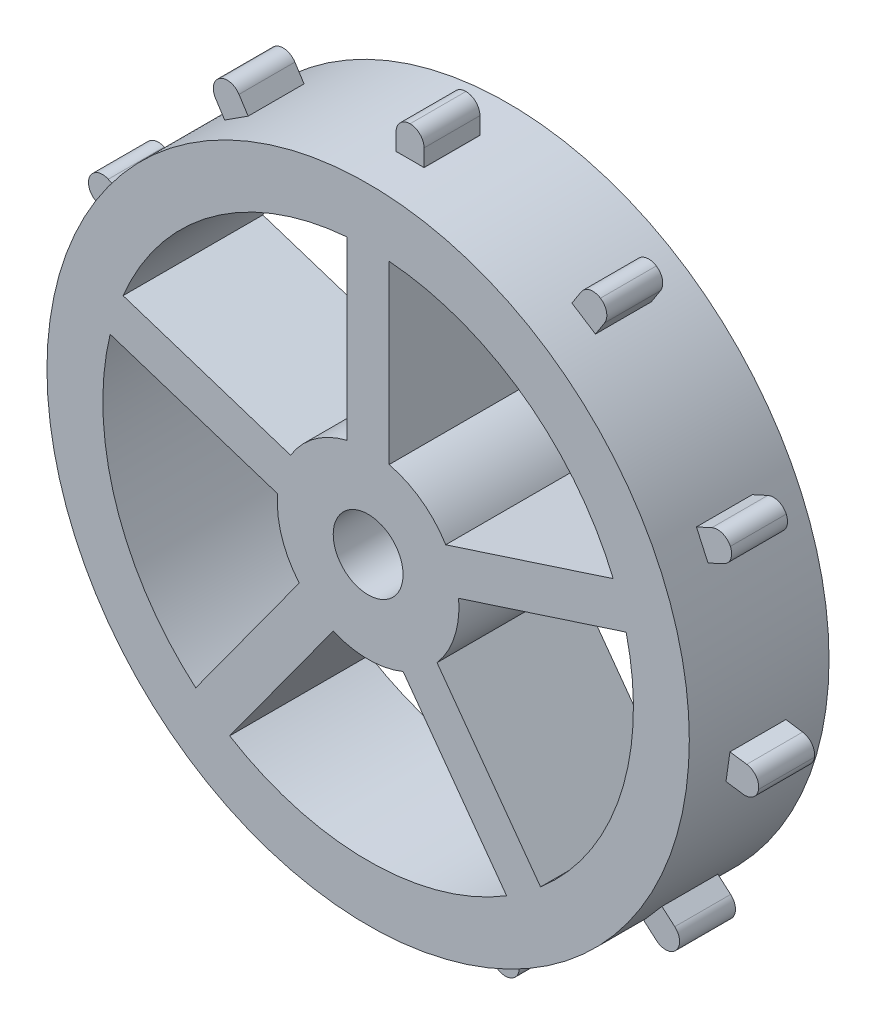
from build123d import *

# Parameters (mm, degrees)
BOSS_EXTRUDE1_DEPTH    = 4
BOSS_EXTRUDE1_2_DEPTH  = 4
BOSS_EXTRUDE1_3_DEPTH  = 4
BOSS_EXTRUDE1_4_DEPTH  = 4
BOSS_EXTRUDE1_5_DEPTH  = 4
BOSS_EXTRUDE1_6_DEPTH  = 4
BOSS_EXTRUDE1_7_DEPTH  = 4
BOSS_EXTRUDE1_8_DEPTH  = 4
BOSS_EXTRUDE1_9_DEPTH  = 4
BOSS_EXTRUDE1_10_DEPTH = 4
BOSS_EXTRUDE1_11_DEPTH = 4
BOSS_EXTRUDE1_12_DEPTH = 4
SKETCH5_R              = 22.988388863
BOSS_EXTRUDE3_DEPTH    = 3
SKETCH6_R              = 22.988388863
BOSS_EXTRUDE4_DEPTH    = 3
SKETCH7_R              = 2.5
CUT_EXTRUDE1_DEPTH     = 10
CUT_EXTRUDE2_DEPTH     = 10
FILLET1_R              = 1
FILLET2_R              = 1
FILLET3_R              = 1
FILLET4_R              = 1
FILLET5_R              = 1
FILLET6_R              = 1
FILLET7_R              = 1
FILLET8_R              = 1
FILLET9_R              = 1
FILLET10_R             = 1
FILLET11_R             = 1


with BuildPart() as part:
    # Sketch2 → Boss-Extrude1 (new body)
    with BuildSketch(Plane.XY):
        with BuildLine():
            Line((-1, 24.966628453), (-1, 22.988388863))
            Line((-1, 22.988388863), (1, 22.988388863))
            Line((1, 22.988388863), (1, 24.966628453))
            ThreePointArc((1, 24.966628453), (0, 25.20269643), (-1, 24.966628453))
        make_face()
    extrude(amount=BOSS_EXTRUDE1_DEPTH)

    # Fillet1
    fillet1_edges = [part.edges().sort_by_distance(p)[0] for p in [
        (-1, 24.966628453, 2),
        (1, 24.966628453, 2),
    ]]
    fillet(fillet1_edges, radius=FILLET1_R - 0.0001)  # a hair under: the kernel refuses the full size


with BuildPart() as body_2:
    # Sketch2 → Boss-Extrude1 2 (new body)
    with BuildSketch(Plane.XY):
        with BuildLine():
            Line((-13.269714879, 18.798422527), (-12.428461559, 19.339063208))
            Line((-12.428461559, 19.339063208), (-11.587207814, 19.879704162))
            Line((-11.587207814, 19.879704162), (-12.656724883, 21.543905206))
            ThreePointArc((-12.656724883, 21.543905206), (-13.6256064, 21.201857409), (-14.339231949, 20.462623571))
            Line((-14.339231949, 20.462623571), (-13.269714879, 18.798422527))
        make_face()
    extrude(amount=BOSS_EXTRUDE1_2_DEPTH)

    # Fillet2
    fillet2_edges = [body_2.edges().sort_by_distance(p)[0] for p in [
        (-14.339231949, 20.462623571, 2),
        (-12.656724883, 21.543905206, 2),
    ]]
    fillet(fillet2_edges, radius=FILLET2_R - 0.0001)  # a hair under: the kernel refuses the full size


with BuildPart() as body_3:
    # Sketch2 → Boss-Extrude1 3 (new body)
    with BuildSketch(Plane.XY):
        with BuildLine():
            Line((1, 22.966628453), (-1, 22.966628453))
            ThreePointArc((-1, 22.966628453), (-6.954904914, 21.911077567), (-12.428461559, 19.339063208))
            ThreePointArc((-12.428461559, 19.339063208), (-17.373465046, 15.054193263), (-20.910973859, 9.549722234))
            ThreePointArc((-20.910973859, 9.549722234), (-22.754400197, 3.271588939), (-22.754400179, -3.271589061))
            ThreePointArc((-22.754400179, -3.271589061), (-20.91097412, -9.549721663), (-17.373465524, -15.054192711))
            ThreePointArc((-17.373465524, -15.054192711), (-12.428461917, -19.339062978), (-6.47657825, -22.057197389))
            ThreePointArc((-6.47657825, -22.057197389), (0, -22.988388863), (6.47657825, -22.057197389))
            ThreePointArc((6.47657825, -22.057197389), (12.42846186, -19.339063015), (17.373465435, -15.054192814))
            ThreePointArc((17.373465435, -15.054192814), (20.910974105, -9.549721696), (22.754400188, -3.271588999))
            ThreePointArc((22.754400188, -3.271588999), (22.754400262, 3.271588485), (20.910974266, 9.549721344))
            ThreePointArc((20.910974266, 9.549721344), (17.373465478, 15.054192764), (12.428461848, 19.339063022))
            ThreePointArc((12.428461848, 19.339063022), (6.954905078, 21.911077515), (1, 22.966628453))
        make_face()
    extrude(amount=BOSS_EXTRUDE1_3_DEPTH)

    # Sketch5 → Boss-Extrude3 (add)
    with BuildSketch(Plane.XY.offset(4)):
        with Locations(Location((0, 0, 0), (0, 0, 92.493165793))):
            Circle(SKETCH5_R)
    extrude(amount=BOSS_EXTRUDE3_DEPTH)

    # Sketch6 → Boss-Extrude4 (add)
    with BuildSketch(Plane(origin=(0, 0, 0), x_dir=(-1, 0, 0), z_dir=(0, 0, -1))):
        Circle(SKETCH6_R)
    extrude(amount=BOSS_EXTRUDE4_DEPTH)

    # Sketch7 → Cut-Extrude1 (cut)
    with BuildSketch(Plane(origin=(0, 0, -3), x_dir=(-1, 0, 0), z_dir=(0, 0, -1))):
        Circle(SKETCH7_R)
    extrude(amount=-CUT_EXTRUDE1_DEPTH, mode=Mode.SUBTRACT)

    # Sketch8 → Cut-Extrude2 (cut)
    with BuildSketch(Plane(origin=(0, 0, -3), x_dir=(-1, 0, 0), z_dir=(0, 0, -1))):
        with BuildLine():
            ThreePointArc((-5.551484059, 3.38097985), (-3.82060414, 5.258610463), (-1.5, 6.32455532))
            Line((-1.5, 6.32455532), (-1.5, 18.929049411))
            ThreePointArc((-1.5, 18.929049411), (-11.161094938, 15.361929286), (-17.539070298, 7.27598273))
            Line((-17.539070298, 7.27598273), (-5.551484059, 3.38097985))
        make_face()
        with BuildLine():
            Line((1.5, 18.929049411), (1.5, 6.32455532))
            ThreePointArc((1.5, 6.32455532), (3.82060414, 5.258610463), (5.551484059, 3.38097985))
            Line((5.551484059, 3.38097985), (17.539070298, 7.27598273))
            ThreePointArc((17.539070298, 7.27598273), (11.161094938, 15.361929286), (1.5, 18.929049411))
        make_face()
        with BuildLine():
            Line((18.466121281, 4.422813181), (6.478535042, 0.527810301))
            ThreePointArc((6.478535042, 0.527810301), (6.494631543, 0.264123294), (6.5, 0))
            ThreePointArc((6.5, 0), (6.095143064, -2.258147699), (4.931005836, -4.234994858))
            Line((4.931005836, -4.234994858), (12.339741575, -14.432244782))
            ThreePointArc((12.339741575, -14.432244782), (17.246314434, -7.945033043), (18.988388863, 0))
            ThreePointArc((18.988388863, 0), (18.857369955, 2.226771197), (18.466121281, 4.422813181))
        make_face()
        with BuildLine():
            ThreePointArc((2.503954853, -5.998350614), (0, -6.5), (-2.503954853, -5.998350614))
            Line((-2.503954853, -5.998350614), (-9.912690592, -16.195600539))
            ThreePointArc((-9.912690592, -16.195600539), (0, -18.988388863), (9.912690592, -16.195600539))
            Line((9.912690592, -16.195600539), (2.503954853, -5.998350614))
        make_face()
        with BuildLine():
            ThreePointArc((-4.931005836, -4.234994858), (-6.181867356, -2.008610463), (-6.478535042, 0.527810301))
            Line((-6.478535042, 0.527810301), (-18.466121281, 4.422813181))
            ThreePointArc((-18.466121281, 4.422813181), (-18.059030962, -5.867734854), (-12.339741575, -14.432244782))
            Line((-12.339741575, -14.432244782), (-4.931005836, -4.234994858))
        make_face()
    extrude(amount=-CUT_EXTRUDE2_DEPTH, mode=Mode.SUBTRACT)


with BuildPart() as body_4:
    # Sketch2 → Boss-Extrude1 4 (new body)
    with BuildSketch(Plane.XY):
        with BuildLine():
            Line((12.656724883, 21.543905206), (11.587207814, 19.879704162))
            Line((11.587207814, 19.879704162), (12.428461848, 19.339063022))
            Line((12.428461848, 19.339063022), (13.269714879, 18.798422527))
            Line((13.269714879, 18.798422527), (14.339231949, 20.462623571))
            ThreePointArc((14.339231949, 20.462623571), (13.6256064, 21.201857409), (12.656724883, 21.543905206))
        make_face()
    extrude(amount=BOSS_EXTRUDE1_4_DEPTH)

    # Fillet8
    fillet8_edges = [body_4.edges().sort_by_distance(p)[0] for p in [
        (14.339231949, 20.462623571, 2),
        (12.656724883, 21.543905206, 2),
    ]]
    fillet(fillet8_edges, radius=FILLET8_R - 0.0001)  # a hair under: the kernel refuses the full size


with BuildPart() as body_5:
    # Sketch2 → Boss-Extrude1 5 (new body)
    with BuildSketch(Plane.XY):
        with BuildLine():
            Line((-20.910973859, 9.549722234), (-20.495559018, 10.459353854))
            Line((-20.495559018, 10.459353854), (-22.295029044, 11.281144279))
            ThreePointArc((-22.295029044, 11.281144279), (-22.925179042, 10.469578465), (-23.12585907, 9.461880288))
            Line((-23.12585907, 9.461880288), (-21.326389044, 8.640089863))
            Line((-21.326389044, 8.640089863), (-20.910973859, 9.549722234))
        make_face()
    extrude(amount=BOSS_EXTRUDE1_5_DEPTH)

    # Fillet3
    fillet3_edges = [body_5.edges().sort_by_distance(p)[0] for p in [
        (-23.12585907, 9.461880288, 2),
        (-22.295029044, 11.281144279, 2),
    ]]
    fillet(fillet3_edges, radius=FILLET3_R - 0.0001)  # a hair under: the kernel refuses the full size


with BuildPart() as body_6:
    # Sketch2 → Boss-Extrude1 6 (new body)
    with BuildSketch(Plane.XY):
        with BuildLine():
            Line((22.295029044, 11.281144279), (20.495559018, 10.459353854))
            Line((20.495559018, 10.459353854), (20.910974266, 9.549721344))
            Line((20.910974266, 9.549721344), (21.326389044, 8.640089863))
            Line((21.326389044, 8.640089863), (23.12585907, 9.461880288))
            ThreePointArc((23.12585907, 9.461880288), (22.925179042, 10.469578465), (22.295029044, 11.281144279))
        make_face()
    extrude(amount=BOSS_EXTRUDE1_6_DEPTH)

    # Fillet9
    fillet9_edges = [body_6.edges().sort_by_distance(p)[0] for p in [
        (22.295029044, 11.281144279, 2),
        (23.12585907, 9.461880288, 2),
    ]]
    fillet(fillet9_edges, radius=FILLET9_R - 0.0001)  # a hair under: the kernel refuses the full size


with BuildPart() as body_7:
    # Sketch2 → Boss-Extrude1 7 (new body)
    with BuildSketch(Plane.XY):
        with BuildLine():
            Line((-22.754400179, -3.271589061), (-22.896715049, -2.281767401))
            Line((-22.896715049, -2.281767401), (-24.854819012, -2.563300249))
            ThreePointArc((-24.854819012, -2.563300249), (-24.94616932, -3.586717667), (-24.570189336, -4.542943132))
            Line((-24.570189336, -4.542943132), (-22.612085372, -4.261410285))
            Line((-22.612085372, -4.261410285), (-22.754400179, -3.271589061))
        make_face()
    extrude(amount=BOSS_EXTRUDE1_7_DEPTH)

    # Fillet4
    fillet4_edges = [body_7.edges().sort_by_distance(p)[0] for p in [
        (-24.854819012, -2.563300249, 2),
        (-24.570189336, -4.542943132, 2),
    ]]
    fillet(fillet4_edges, radius=FILLET4_R - 0.0001)  # a hair under: the kernel refuses the full size


with BuildPart() as body_8:
    # Sketch2 → Boss-Extrude1 8 (new body)
    with BuildSketch(Plane.XY):
        with BuildLine():
            Line((24.854819012, -2.563300249), (22.896715049, -2.281767401))
            Line((22.896715049, -2.281767401), (22.754400188, -3.271588999))
            Line((22.754400188, -3.271588999), (22.612085372, -4.261410285))
            Line((22.612085372, -4.261410285), (24.570189336, -4.542943132))
            ThreePointArc((24.570189336, -4.542943132), (24.94616932, -3.586717667), (24.854819012, -2.563300249))
        make_face()
    extrude(amount=BOSS_EXTRUDE1_8_DEPTH)

    # Fillet10
    fillet10_edges = [body_8.edges().sort_by_distance(p)[0] for p in [
        (24.854819012, -2.563300249, 2),
        (24.570189336, -4.542943132, 2),
    ]]
    fillet(fillet10_edges, radius=FILLET10_R - 0.0001)  # a hair under: the kernel refuses the full size


with BuildPart() as body_9:
    # Sketch2 → Boss-Extrude1 9 (new body)
    with BuildSketch(Plane.XY):
        with BuildLine():
            Line((-17.373465524, -15.054192711), (-18.028325832, -14.298443628))
            Line((-18.028325832, -14.298443628), (-19.52337956, -15.593915058))
            ThreePointArc((-19.52337956, -15.593915058), (-19.0469271, -16.504256282), (-18.213658092, -17.105414207))
            Line((-18.213658092, -17.105414207), (-16.718604364, -15.809942777))
            Line((-16.718604364, -15.809942777), (-17.373465524, -15.054192711))
        make_face()
    extrude(amount=BOSS_EXTRUDE1_9_DEPTH)

    # Fillet5
    fillet5_edges = [body_9.edges().sort_by_distance(p)[0] for p in [
        (-18.213658092, -17.105414207, 2),
        (-19.52337956, -15.593915058, 2),
    ]]
    fillet(fillet5_edges, radius=FILLET5_R - 0.0001)  # a hair under: the kernel refuses the full size


with BuildPart() as body_10:
    # Sketch2 → Boss-Extrude1 10 (new body)
    with BuildSketch(Plane.XY):
        with BuildLine():
            Line((-6.47657825, -22.057197389), (-7.436070546, -21.775465031))
            Line((-7.436070546, -21.775465031), (-7.993405043, -23.673572019))
            ThreePointArc((-7.993405043, -23.673572019), (-7.100420105, -24.181810141), (-6.074419096, -24.237037132))
            Line((-6.074419096, -24.237037132), (-5.517084598, -22.338930145))
            Line((-5.517084598, -22.338930145), (-6.47657825, -22.057197389))
        make_face()
    extrude(amount=BOSS_EXTRUDE1_10_DEPTH)

    # Fillet6
    fillet6_edges = [body_10.edges().sort_by_distance(p)[0] for p in [
        (-7.993405043, -23.673572019, 2),
        (-6.074419096, -24.237037132, 2),
    ]]
    fillet(fillet6_edges, radius=FILLET6_R - 0.0001)  # a hair under: the kernel refuses the full size


with BuildPart() as body_11:
    # Sketch2 → Boss-Extrude1 11 (new body)
    with BuildSketch(Plane.XY):
        with BuildLine():
            Line((19.52337956, -15.593915058), (18.028325832, -14.298443628))
            Line((18.028325832, -14.298443628), (17.373465435, -15.054192814))
            Line((17.373465435, -15.054192814), (16.718604364, -15.809942777))
            Line((16.718604364, -15.809942777), (18.213658092, -17.105414207))
            ThreePointArc((18.213658092, -17.105414207), (19.0469271, -16.504256282), (19.52337956, -15.593915058))
        make_face()
    extrude(amount=BOSS_EXTRUDE1_11_DEPTH)

    # Fillet11
    fillet11_edges = [body_11.edges().sort_by_distance(p)[0] for p in [
        (18.213658092, -17.105414207, 2),
        (19.52337956, -15.593915058, 2),
    ]]
    fillet(fillet11_edges, radius=FILLET11_R - 0.0001)  # a hair under: the kernel refuses the full size


with BuildPart() as body_12:
    # Sketch2 → Boss-Extrude1 12 (new body)
    with BuildSketch(Plane.XY):
        with BuildLine():
            Line((6.47657825, -22.057197389), (5.517084598, -22.338930145))
            Line((5.517084598, -22.338930145), (6.074419096, -24.237037132))
            ThreePointArc((6.074419096, -24.237037132), (7.100420105, -24.181810141), (7.993405043, -23.673572019))
            Line((7.993405043, -23.673572019), (7.436070546, -21.775465031))
            Line((7.436070546, -21.775465031), (6.47657825, -22.057197389))
        make_face()
    extrude(amount=BOSS_EXTRUDE1_12_DEPTH)

    # Fillet7
    fillet7_edges = [body_12.edges().sort_by_distance(p)[0] for p in [
        (7.993405043, -23.673572019, 2),
        (6.074419096, -24.237037132, 2),
    ]]
    fillet(fillet7_edges, radius=FILLET7_R - 0.0001)  # a hair under: the kernel refuses the full size


solid = Compound([part.part, body_2.part, body_3.part, body_4.part, body_5.part, body_6.part, body_7.part, body_8.part, body_9.part, body_10.part, body_11.part, body_12.part])
